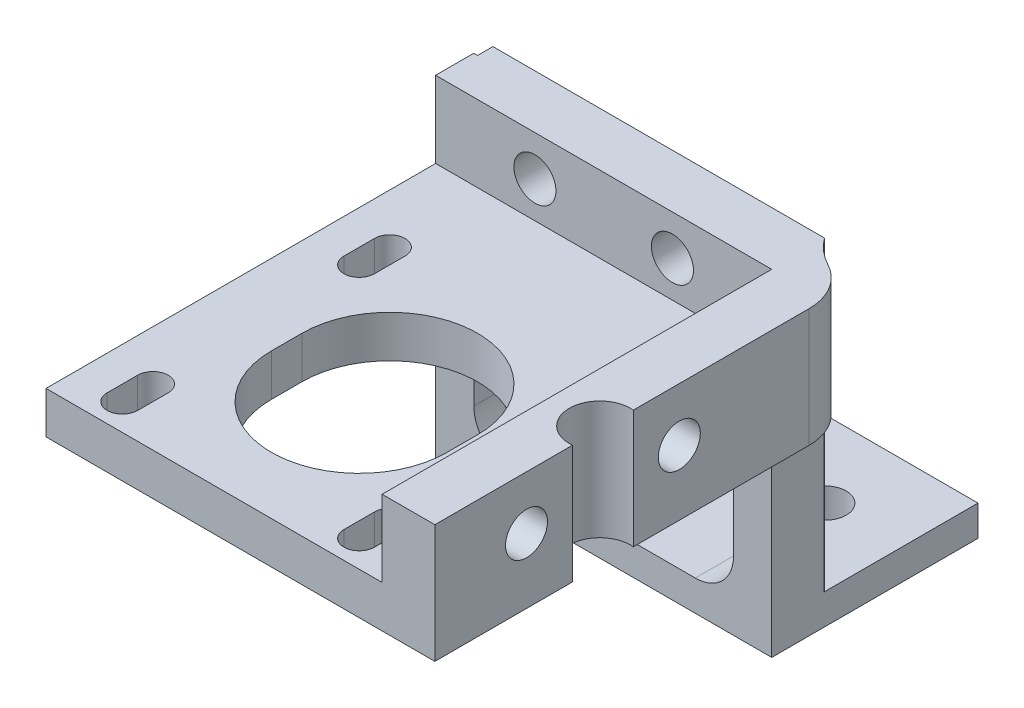
from build123d import *

# Parameters (mm, degrees)
BOSS_EXTRUDE1_DEPTH      = 42
BOSS_EXTRUDE1_DEPTH_BACK = 42
SKETCH2_R                = 2.75
SKETCH2_W                = 15
SKETCH2_H                = 2.5
CUT_EXTRUDE1_DEPTH       = 100.161484458
SKETCH3_R                = 4
SKETCH3_W                = 15
SKETCH3_H                = 60
CUT_EXTRUDE2_DEPTH       = 101.743486312
SKETCH4_W                = 44
SKETCH4_H                = 46.5
CUT_EXTRUDE3_DEPTH       = 60
CUT_EXTRUDE4_DEPTH       = 10
CUT_EXTRUDE4_DEPTH_BACK  = 10
SKETCH5_W                = 44
SKETCH5_H                = 51
SKETCH6_R                = 2.75
CUT_EXTRUDE5_DEPTH       = 4.6
SKETCH7_W                = 15
SKETCH7_H                = 62
CUT_EXTRUDE6_DEPTH       = 63
SKETCH8_W                = 54
SKETCH8_H                = 22
CUT_EXTRUDE7_DEPTH       = 63
SKETCH9_W                = 54
SKETCH9_H                = 27
BOSS_EXTRUDE2_DEPTH      = 4
FILLET1_R                = 5
SKETCH12_W               = 5
SKETCH12_H               = 11.450523872
BOSS_EXTRUDE4_DEPTH      = 4
CUT_EXTRUDE8_START       = -113
SKETCH13_R               = 65
CUT_EXTRUDE8_DEPTH       = 113
SKETCH14_R               = 2.75
CUT_EXTRUDE9_DEPTH       = 15
SKETCH15_R               = 2.75
CUT_EXTRUDE10_DEPTH      = 15
SKETCH16_W               = 5
SKETCH16_H               = 46.5
CUT_EXTRUDE11_DEPTH      = 90
SKETCH17_W               = 9
SKETCH17_H               = 18
CUT_EXTRUDE12_DEPTH      = 90
SKETCH23_W               = 56
SKETCH23_H               = 15.5
BOSS_EXTRUDE10_DEPTH     = 6.9
SKETCH18_W               = 56
SKETCH18_H               = 15.5
SKETCH18_R               = 2.75
BOSS_EXTRUDE5_DEPTH      = 6.5
SKETCH19_R               = 4
CUT_EXTRUDE13_DEPTH      = 36
FILLET2_R                = 7
FILLET5_R                = 7
SKETCH24_R               = 2.75
CUT_EXTRUDE14_DEPTH      = 6.5
SKETCH26_W               = 56
SKETCH26_H               = 15.5
CUT_EXTRUDE15_DEPTH      = 6.5
SKETCH27_R               = 2.75
BOSS_EXTRUDE11_DEPTH     = 2
FILLET6_R                = 10


with BuildPart() as part:
    # Sketch1 → Boss-Extrude1 (new, two sides: drawn at the far end of the back side and taken through both)
    with BuildSketch(Plane(origin=(0, 0, 0), x_dir=(0, 0, -1), z_dir=(1, 0, 0)).offset(-BOSS_EXTRUDE1_DEPTH_BACK)):
        with BuildLine():
            Line((0, 0), (0, -62))
            Line((0, -62), (-5, -62))
            ThreePointArc((-5, -62), (-27.506882202, -29.081460906), (-65, -15.5))
            Line((-65, -15.5), (-65, 2.5))
            Line((-65, 2.5), (-56, 2.5))
            ThreePointArc((-56, 2.5), (-30.901836055, -6.947455525), (-5, 0))
            Line((-5, 0), (0, 0))
        make_face()
    extrude(amount=BOSS_EXTRUDE1_DEPTH + BOSS_EXTRUDE1_DEPTH_BACK)

    # Sketch2 → Cut-Extrude1 (cut, through all)
    with BuildSketch(Plane(origin=(0, 0, 0), x_dir=(-1, 0, 0), z_dir=(0, 0, -1))):
        with Locations(Location((-36, -6, 0), (0, 0, 90))):
            Circle(SKETCH2_R)
        with BuildLine():
            ThreePointArc((-42, -53.6792), (-32.778829166, -31), (-42, -8.3208))
            Line((-42, -8.3208), (-42, -53.6792))
        make_face()
        with BuildLine():
            ThreePointArc((-17, -25.5), (-15.535533906, -21.964466094), (-12, -20.5))
            Line((-12, -20.5), (12, -20.5))
            ThreePointArc((12, -20.5), (15.535533906, -21.964466094), (17, -25.5))
            Line((17, -25.5), (17, -49))
            ThreePointArc((17, -49), (15.535533906, -52.535533906), (12, -54))
            Line((12, -54), (-12, -54))
            ThreePointArc((-12, -54), (-15.535533906, -52.535533906), (-17, -49))
            Line((-17, -49), (-17, -25.5))
        make_face()
        with Locations(Location((-36, -56, 0), (0, 0, 90))):
            Circle(SKETCH2_R)
        with Locations(Location((36, -56, 0), (0, 0, 90))):
            Circle(SKETCH2_R)
        with Locations(Location((36, -6, 0), (0, 0, 90))):
            Circle(SKETCH2_R)
        with Locations((34.5, 1.25)):
            Rectangle(SKETCH2_W, SKETCH2_H)
        with Locations((-34.5, 1.25)):
            Rectangle(SKETCH2_W, SKETCH2_H)
        with BuildLine():
            Line((42, -53.6792), (42, -8.3208))
            ThreePointArc((42, -8.3208), (32.778829166, -31), (42, -53.6792))
        make_face()
    extrude(amount=-CUT_EXTRUDE1_DEPTH, mode=Mode.SUBTRACT)

    # Sketch3 → Cut-Extrude2 (cut, through all)
    with BuildSketch(Plane(origin=(0, -62, 0), x_dir=(-1, 0, 0), z_dir=(0, -1, 0))):
        with Locations((0, -65)):
            Circle(SKETCH3_R)
        with Locations((34.5, -35)):
            Rectangle(SKETCH3_W, SKETCH3_H)
        with Locations((-34.5, -35)):
            Rectangle(SKETCH3_W, SKETCH3_H)
        with BuildLine():
            Line((11.5, -33), (11.5, -37))
            ThreePointArc((11.5, -37), (0, -48.5), (-11.5, -37))
            Line((-11.5, -37), (-11.5, -33))
            ThreePointArc((-11.5, -33), (0, -21.5), (11.5, -33))
        make_face()
        with BuildLine():
            Line((17.5, -48.5), (17.5, -52.5))
            ThreePointArc((17.5, -52.5), (15.5, -54.5), (13.5, -52.5))
            Line((13.5, -52.5), (13.5, -48.5))
            ThreePointArc((13.5, -48.5), (15.5, -46.5), (17.5, -48.5))
        make_face()
        with BuildLine():
            Line((17.5, -17.5), (17.5, -21.5))
            ThreePointArc((17.5, -21.5), (15.5, -23.5), (13.5, -21.5))
            Line((13.5, -21.5), (13.5, -17.5))
            ThreePointArc((13.5, -17.5), (15.5, -15.5), (17.5, -17.5))
        make_face()
        with BuildLine():
            Line((-17.5, -17.5), (-17.5, -21.5))
            ThreePointArc((-17.5, -21.5), (-15.5, -23.5), (-13.5, -21.5))
            Line((-13.5, -21.5), (-13.5, -17.5))
            ThreePointArc((-13.5, -17.5), (-15.5, -15.5), (-17.5, -17.5))
        make_face()
        with BuildLine():
            Line((-17.5, -48.5), (-17.5, -52.5))
            ThreePointArc((-17.5, -52.5), (-15.5, -54.5), (-13.5, -52.5))
            Line((-13.5, -52.5), (-13.5, -48.5))
            ThreePointArc((-13.5, -48.5), (-15.5, -46.5), (-17.5, -48.5))
        make_face()
    extrude(amount=-CUT_EXTRUDE2_DEPTH, mode=Mode.SUBTRACT)

    # Sketch4 → Cut-Extrude3 (cut)
    with BuildSketch(Plane.XY.offset(65)):
        with Locations((0, -38.75)):
            Rectangle(SKETCH4_W, SKETCH4_H)
    extrude(amount=-CUT_EXTRUDE3_DEPTH, mode=Mode.SUBTRACT)

    # Sketch5 → Cut-Extrude4 (cut, two sides: drawn at the far end of the back side and taken through both)
    with BuildSketch(Plane(origin=(0, 0, 0), x_dir=(1, 0, 0), z_dir=(0, 1, 0)).offset(-CUT_EXTRUDE4_DEPTH_BACK)):
        with Locations((0, -30.5)):
            Rectangle(SKETCH5_W, SKETCH5_H)
    extrude(amount=CUT_EXTRUDE4_DEPTH + CUT_EXTRUDE4_DEPTH_BACK, mode=Mode.SUBTRACT)

    # Sketch6 → Cut-Extrude5 (cut)
    with BuildSketch(Plane.XY.offset(65)):
        with Locations((-10, -5.5)):
            Circle(SKETCH6_R)
        with Locations((10, -5.5)):
            Circle(SKETCH6_R)
    extrude(amount=-CUT_EXTRUDE5_DEPTH, mode=Mode.SUBTRACT)

    # Sketch7 → Cut-Extrude6 (cut)
    with BuildSketch(Plane.XY.offset(5)):
        with Locations((34.5, -31)):
            Rectangle(SKETCH7_W, SKETCH7_H)
        with Locations((-34.5, -31)):
            Rectangle(SKETCH7_W, SKETCH7_H)
    extrude(amount=-CUT_EXTRUDE6_DEPTH, mode=Mode.SUBTRACT)

    # Sketch8 → Cut-Extrude7 (cut)
    with BuildSketch(Plane(origin=(0, 0, 0), x_dir=(-1, 0, 0), z_dir=(0, 0, -1))):
        with Locations((0, -51)):
            Rectangle(SKETCH8_W, SKETCH8_H)
    extrude(amount=-CUT_EXTRUDE7_DEPTH, mode=Mode.SUBTRACT)

    # Sketch9 → Boss-Extrude2 (add)
    with BuildSketch(Plane.XZ.offset(40)):
        with Locations((0, -8.5)):
            Rectangle(SKETCH9_W, SKETCH9_H)
    extrude(amount=BOSS_EXTRUDE2_DEPTH)

    # Fillet1
    fillet1_edges = [part.edges().sort_by_distance(p)[0] for p in [
        (17, -40, 2.5),
        (-17, -40, 2.5),
    ]]
    fillet(fillet1_edges, radius=FILLET1_R)

    # Sketch12 → Boss-Extrude4 (add)
    with BuildSketch(Plane.XZ.offset(40)):
        with Locations((-24.5, 10.725261936)):
            Rectangle(SKETCH12_W, SKETCH12_H)
        with Locations((24.5, 10.725261936)):
            Rectangle(SKETCH12_W, SKETCH12_H)
    extrude(amount=BOSS_EXTRUDE4_DEPTH)

    # Sketch13 → Cut-Extrude8 (cut)
    with BuildSketch(Plane(origin=(27, 0, 0), x_dir=(0, 0, -1), z_dir=(1, 0, 0)).offset(CUT_EXTRUDE8_START)):
        with Locations((-67.324040456, -80.458439297)):
            Circle(SKETCH13_R)
    extrude(amount=CUT_EXTRUDE8_DEPTH, mode=Mode.SUBTRACT)

    # Sketch14 → Cut-Extrude9 (cut)
    with BuildSketch(Plane.XZ.offset(44)):
        with Locations(Location((12, -12, 0), (0, 0, 270))):
            Circle(SKETCH14_R)
        with Locations(Location((-12, -12, 0), (0, 0, 270))):
            Circle(SKETCH14_R)
    extrude(amount=-CUT_EXTRUDE9_DEPTH, mode=Mode.SUBTRACT)

    # Sketch15 → Cut-Extrude10 (cut)
    with BuildSketch(Plane.XY.offset(5)):
        with Locations((9, -5.25)):
            Circle(SKETCH15_R)
        with Locations((-9, -5.25)):
            Circle(SKETCH15_R)
    extrude(amount=-CUT_EXTRUDE10_DEPTH, mode=Mode.SUBTRACT)

    # Sketch16 → Cut-Extrude11 (cut)
    with BuildSketch(Plane.XY.offset(65)):
        with Locations((-24.5, -20.75)):
            Rectangle(SKETCH16_W, SKETCH16_H)
        with Locations((24.5, -20.75)):
            Rectangle(SKETCH16_W, SKETCH16_H)
    extrude(amount=-CUT_EXTRUDE11_DEPTH, mode=Mode.SUBTRACT)

    # Sketch17 → Cut-Extrude12 (cut)
    with BuildSketch(Plane.ZY.offset(22)):
        with Locations((60.5, -6.5)):
            Rectangle(SKETCH17_W, SKETCH17_H)
    extrude(amount=-CUT_EXTRUDE12_DEPTH, mode=Mode.SUBTRACT)

    # Sketch23 → Boss-Extrude10 (add)
    with BuildSketch(Plane(origin=(22, 0, 0), x_dir=(0, 0, -1), z_dir=(1, 0, 0))):
        with Locations((-28, -7.75)):
            Rectangle(SKETCH23_W, SKETCH23_H)
    extrude(amount=BOSS_EXTRUDE10_DEPTH)

    # Sketch18 → Boss-Extrude5 (add)
    with BuildSketch(Plane.ZY.offset(22)):
        with Locations((28, -7.75)):
            Rectangle(SKETCH18_W, SKETCH18_H)
        with Locations(Location((24, -7.25, 0), (0, 0, 270))):
            Circle(SKETCH18_R, mode=Mode.SUBTRACT)
        with Locations(Location((44, -7.25, 0), (0, 0, 270))):
            Circle(SKETCH18_R, mode=Mode.SUBTRACT)
    extrude(amount=BOSS_EXTRUDE5_DEPTH)

    # Sketch19 → Cut-Extrude13 (cut)
    with BuildSketch(Plane.XZ.offset(15.5)):
        with Locations((-28.5, 34)):
            Circle(SKETCH19_R)
    cut_extrude13 = extrude(amount=-CUT_EXTRUDE13_DEPTH, mode=Mode.SUBTRACT)

    # Fillet2
    fillet2_edges = [part.edges().sort_by_distance(p)[0] for p in [
        (-28.5, -7.75, 0),
    ]]
    fillet(fillet2_edges, radius=FILLET2_R)

    # Mirror5: Cut-Extrude13 across plane
    add(cut_extrude13.mirror(Plane(origin=(0, 0, 0), x_dir=(0, 0, 1), z_dir=(1, 0, 0))), mode=Mode.SUBTRACT)

    # Fillet5
    fillet5_edges = [part.edges().sort_by_distance(p)[0] for p in [
        (28.9, -7.75, 0),
    ]]
    fillet(fillet5_edges, radius=FILLET5_R)

    # Sketch24 → Cut-Extrude14 (cut)
    with BuildSketch(Plane(origin=(28.9, 0, 0), x_dir=(0, 0, -1), z_dir=(1, 0, 0))):
        with Locations((-44, -7)):
            Circle(SKETCH24_R)
        with Locations((-24, -7)):
            Circle(SKETCH24_R)
    extrude(amount=-CUT_EXTRUDE14_DEPTH, mode=Mode.SUBTRACT)

    # Sketch26 → Cut-Extrude15 (cut)
    with BuildSketch(Plane.ZY.offset(28.5)):
        with Locations((28, -7.75)):
            Rectangle(SKETCH26_W, SKETCH26_H)
    extrude(amount=-CUT_EXTRUDE15_DEPTH, mode=Mode.SUBTRACT)

    # Sketch27 → Boss-Extrude11 (add)
    with BuildSketch(Plane(origin=(0, 0, 0), x_dir=(-1, 0, 0), z_dir=(0, 0, -1))):
        with BuildLine():
            Line((21.5, -40), (21.5, 0))
            Line((21.5, 0), (-21.9, 0))
            Line((-21.9, 0), (-21.9, -40))
            Line((-21.9, -40), (-12, -40))
            ThreePointArc((-12, -40), (-15.535533906, -38.535533906), (-17, -35))
            Line((-17, -35), (-17, -25.5))
            ThreePointArc((-17, -25.5), (-15.535533906, -21.964466094), (-12, -20.5))
            Line((-12, -20.5), (12, -20.5))
            ThreePointArc((12, -20.5), (15.535533906, -21.964466094), (17, -25.5))
            Line((17, -25.5), (17, -35))
            ThreePointArc((17, -35), (15.535533906, -38.535533906), (12, -40))
            Line((12, -40), (21.5, -40))
        make_face()
        with Locations(Location((9, -5.25, 0), (0, 0, 180))):
            Circle(SKETCH27_R, mode=Mode.SUBTRACT)
        with Locations(Location((-9, -5.25, 0), (0, 0, 180))):
            Circle(SKETCH27_R, mode=Mode.SUBTRACT)
    extrude(amount=BOSS_EXTRUDE11_DEPTH)

    # Fillet6
    # the kernel refuses this fillet: 10 mm, written as the material it adds along each edge
    with BuildSketch(Plane(origin=(21.9, -40, 0), x_dir=(0, 0, -1), z_dir=(0, 1, 0))) as fillet6_piece_1_section:
        with BuildLine():
            CenterArc((8, -8), FILLET6_R, 126.869897646, 25.057615418)
            Line((-0.823529412, -3.294117647), (-1, -3.2))
            ThreePointArc((-1, -3.2), (-0.403030999, -1.64924225), (-0.2, 0))
            Line((-0.2, 0), (0, 0.2))
            ThreePointArc((0, 0.2), (1, 0.2), (1.88, 0.16))
            Line((1.88, 0.16), (2, 0))
        make_face()
    fillet6_piece_1 = extrude(amount=40, mode=Mode.PRIVATE)
    fillet6_piece_1 = split(fillet6_piece_1, bisect_by=Plane(origin=(22, -27.75, -0.877476934), z_dir=(-1, 0, 0)), keep=Keep.TOP, mode=Mode.PRIVATE)
    fillet6_piece_1 = split(fillet6_piece_1, bisect_by=Plane(origin=(21.85575196, -15.5, -0.877476934), z_dir=(0, -1, 0)), keep=Keep.TOP, mode=Mode.PRIVATE)
    add(fillet6_piece_1)
    with BuildSketch(Plane(origin=(21.9, -40, 0), x_dir=(0, 0, -1), z_dir=(0, 1, 0))) as fillet6_piece_2_section:
        with BuildLine():
            CenterArc((8, -8), FILLET6_R, 126.869897646, 25.057615418)
            Line((-0.823529412, -3.294117647), (-1, -3.2))
            ThreePointArc((-1, -3.2), (-0.403030999, -1.64924225), (-0.2, 0))
            Line((-0.2, 0), (0, 0.2))
            ThreePointArc((0, 0.2), (1, 0.2), (1.88, 0.16))
            Line((1.88, 0.16), (2, 0))
        make_face()
    fillet6_piece_2 = extrude(amount=40, mode=Mode.PRIVATE)
    fillet6_piece_2 = split(fillet6_piece_2, bisect_by=Plane(origin=(22, -7.75, -0.877476934), z_dir=(-1, 0, 0)), keep=Keep.TOP, mode=Mode.PRIVATE)
    fillet6_piece_2 = split(fillet6_piece_2, bisect_by=Plane(origin=(21.85575196, -15.5, -0.877476934), z_dir=(0, 1, 0)), keep=Keep.TOP, mode=Mode.PRIVATE)
    add(fillet6_piece_2)
    with BuildSketch(Plane(origin=(21.9, -40, 0), x_dir=(0, 0, -1), z_dir=(0, 1, 0))) as fillet6_piece_3_section:
        with BuildLine():
            CenterArc((8, -8), FILLET6_R, 126.869897646, 25.057615418)
            Line((-0.823529412, -3.294117647), (-1, -3.2))
            ThreePointArc((-1, -3.2), (-0.403030999, -1.64924225), (-0.2, 0))
            Line((-0.2, 0), (0, 0.2))
            ThreePointArc((0, 0.2), (1, 0.2), (1.88, 0.16))
            Line((1.88, 0.16), (2, 0))
        make_face()
    fillet6_piece_3 = extrude(amount=40, mode=Mode.PRIVATE)
    fillet6_piece_3 = split(fillet6_piece_3, bisect_by=Plane(origin=(22, -7.75, -0.252980479), z_dir=(1, 0, 0)), keep=Keep.TOP, mode=Mode.PRIVATE)
    fillet6_piece_3 = split(fillet6_piece_3, bisect_by=Plane(origin=(22.996225297, -15.5, -0.252980479), z_dir=(0, 1, 0)), keep=Keep.TOP, mode=Mode.PRIVATE)
    add(fillet6_piece_3)


solid = part.part
